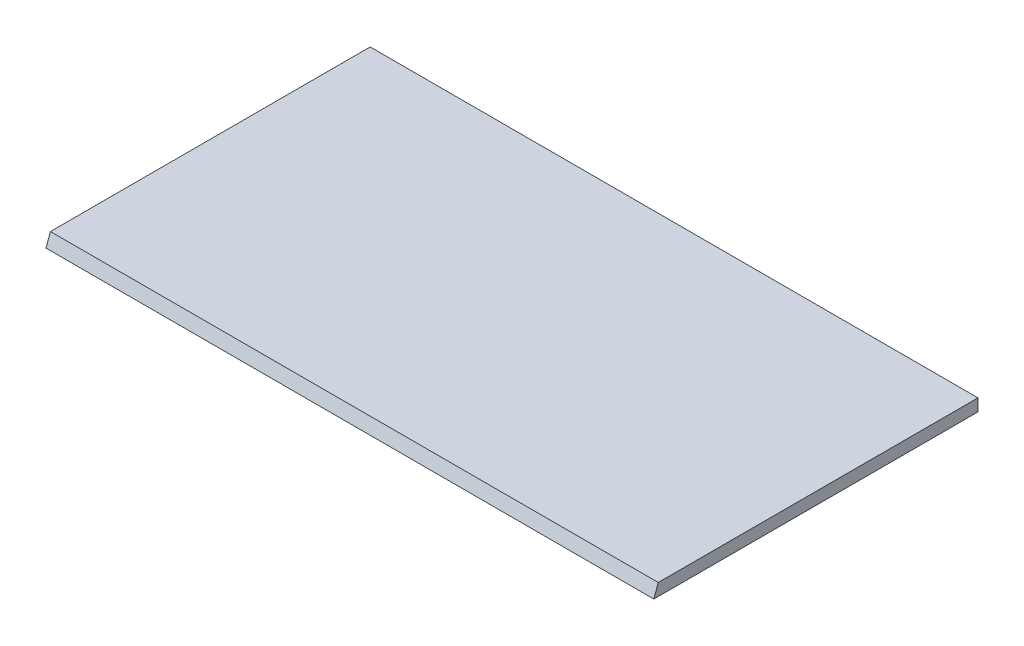
from build123d import *

# Parameters (mm, degrees)
ESQUISSE1_W        = 150
ESQUISSE1_H        = 80
BOSS_EXTRU_1_DEPTH = 3
CHANFREIN2_SIZE2   = 1.091910703
CHANFREIN2_SIZE    = 3


with BuildPart() as part:
    # Esquisse1 → Boss.-Extru.1 (new body)
    with BuildSketch(Plane(origin=(0, 0, 0), x_dir=(1, 0, 0), z_dir=(0, 1, 0))):
        with Locations((75, 40)):
            Rectangle(ESQUISSE1_W, ESQUISSE1_H)
    extrude(amount=BOSS_EXTRU_1_DEPTH)

    # Chanfrein2
    chanfrein2_edges = [part.edges().sort_by_distance(p)[0] for p in [
        (75, 3, 0),
    ]]
    chanfrein2_side = [part.faces().sort_by_distance(p)[0] for p in [
        (75, 2.978161786, 0),
    ]]
    chamfer(chanfrein2_edges, length=CHANFREIN2_SIZE - 0.0001, length2=CHANFREIN2_SIZE2 - 0.0001, reference=chanfrein2_side[0])  # a hair under: the kernel refuses the full size


solid = part.part
